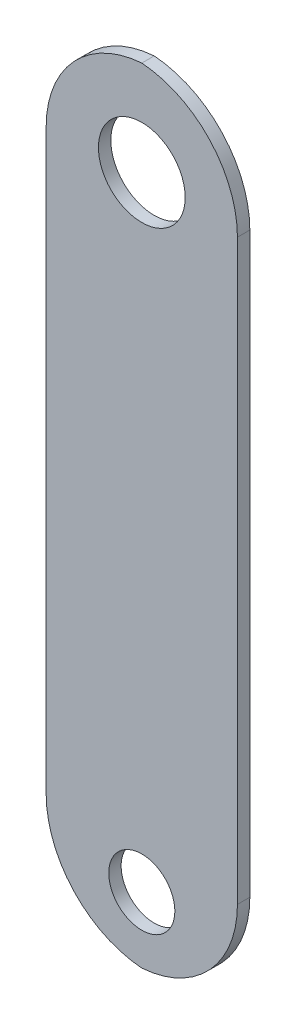
from build123d import *

# Parameters (mm, degrees)
SKETCH1_W           = 46.3
SKETCH1_H           = 189.86
SKETCH1_R           = 10.5
SKETCH1_R_2         = 8
BOSS_EXTRUDE1_DEPTH = 3
FILLET1_R           = 25


with BuildPart() as part:
    # Sketch1 → Boss-Extrude1 (new body)
    with BuildSketch(Plane.XY):
        Rectangle(SKETCH1_W, SKETCH1_H)
        with Locations((0, 71.93)):
            Circle(SKETCH1_R, mode=Mode.SUBTRACT)
        with Locations((0, -78.93)):
            Circle(SKETCH1_R_2, mode=Mode.SUBTRACT)
    extrude(amount=BOSS_EXTRUDE1_DEPTH)

    # Fillet1
    # the kernel refuses this fillet: 25 mm, written as the material it takes off along each edge
    with BuildSketch(Plane(origin=(23.15, -94.93, -62.5), x_dir=(-1, 0, 0), z_dir=(0, 0, 1))) as fillet1_piece_1:
        with BuildLine():
            CenterArc((FILLET1_R, -FILLET1_R), FILLET1_R, 90, 90)
            Line((0, -FILLET1_R), (0, 0))
            Line((0, 0), (FILLET1_R, 0))
        make_face()
    extrude(amount=128, mode=Mode.SUBTRACT)
    with BuildSketch(Plane(origin=(-23.15, -94.93, -62.5), x_dir=(1, 0, 0), z_dir=(0, 0, 1)), Plane(origin=(-23.15, 94.93, -62.5), x_dir=(0, -1, 0), z_dir=(0, 0, 1)), Plane(origin=(23.15, 94.93, -62.5), x_dir=(-1, 0, 0), z_dir=(0, 0, 1))) as fillet1_piece_2:
        with BuildLine():
            CenterArc((FILLET1_R, FILLET1_R), FILLET1_R, 180, 90)
            Line((0, FILLET1_R), (0, 0))
            Line((0, 0), (FILLET1_R, 0))
        make_face()
    extrude(amount=128, mode=Mode.SUBTRACT)


solid = part.part
